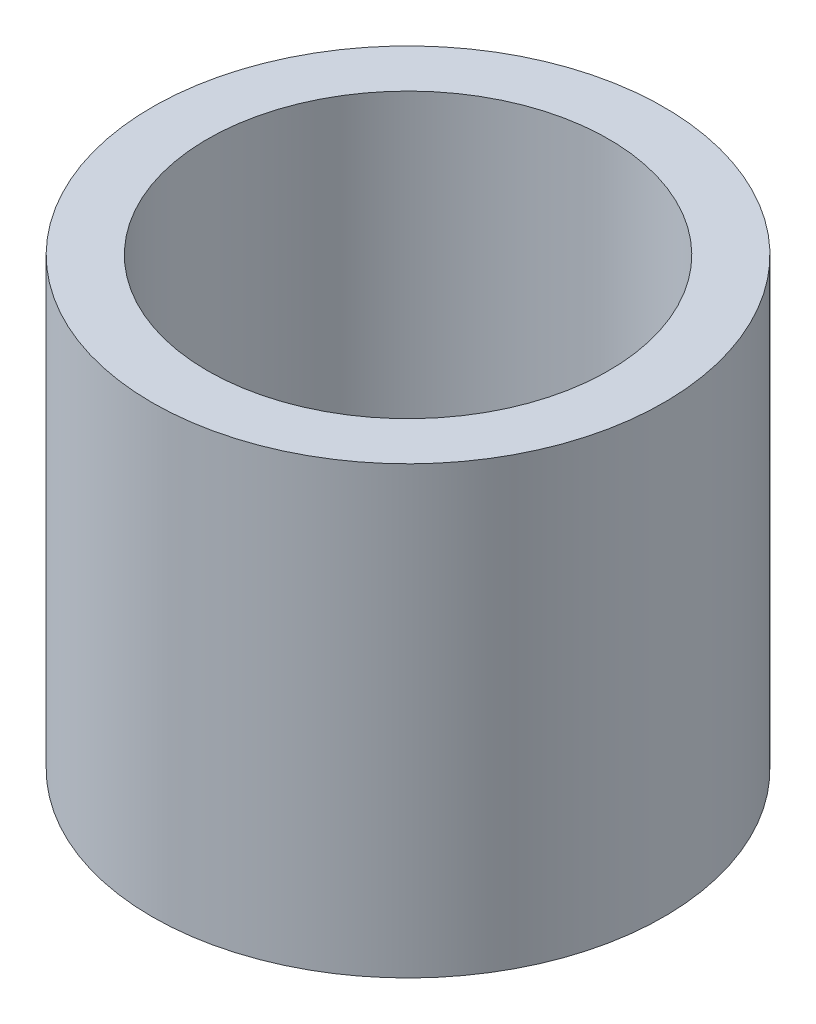
from build123d import *

# Parameters (mm, degrees)
SKETCH1_R           = 3.175
SKETCH1_R_2         = 2.4892
BOSS_EXTRUDE1_DEPTH = 5.5245


with BuildPart() as part:
    # Sketch1 → Boss-Extrude1 (new body)
    with BuildSketch(Plane(origin=(0, 0, 0), x_dir=(1, 0, 0), z_dir=(0, 1, 0))):
        Circle(SKETCH1_R)
        Circle(SKETCH1_R_2, mode=Mode.SUBTRACT)
    extrude(amount=BOSS_EXTRUDE1_DEPTH)


solid = part.part
